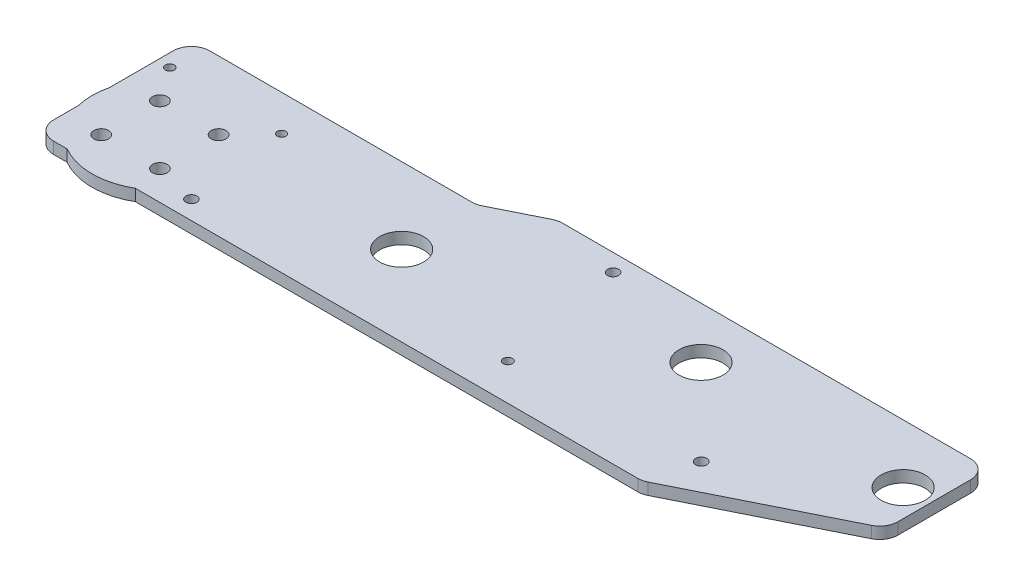
from build123d import *

# Parameters (mm, degrees)
SKETCH1_W           = 210
SKETCH1_H           = 50
SKETCH1_R           = 1.211665018
SKETCH1_R_2         = 1.165617118
SKETCH1_R_3         = 1.5
SKETCH1_R_4         = 1.25
SKETCH1_R_5         = 1.517273905
BOSS_EXTRUDE1_DEPTH = 3.175
SKETCH2_R           = 2
CUT_EXTRUDE1_DEPTH  = 10
SKETCH3_R           = 6
SKETCH3_R_2         = 0.586995366
CUT_EXTRUDE2_DEPTH  = 57.15
CUT_EXTRUDE7_DEPTH  = 10
FILLET3_R           = 5
SKETCH11_R          = 18.5
SKETCH11_R_2        = 2
BOSS_EXTRUDE4_DEPTH = 3.175


with BuildPart() as part:
    # Sketch1 → Boss-Extrude1 (new body)
    with BuildSketch(Plane(origin=(0, 0, 0), x_dir=(1, 0, 0), z_dir=(0, 1, 0))):
        with Locations((105, -25)):
            Rectangle(SKETCH1_W, SKETCH1_H)
        with Locations((3.489526233, -16.787661112)):
            Circle(SKETCH1_R, mode=Mode.SUBTRACT)
        with Locations((34.37258772, -17.194005245)):
            Circle(SKETCH1_R_2, mode=Mode.SUBTRACT)
        with Locations((37.520749958, -44.921198121)):
            Circle(SKETCH1_R_3, mode=Mode.SUBTRACT)
        with Locations((118.879039361, -40.017685043)):
            Circle(SKETCH1_R_4, mode=Mode.SUBTRACT)
        with Locations((112.302052499, -4.739260115)):
            Circle(SKETCH1_R_3, mode=Mode.SUBTRACT)
        with Locations((168.975233936, -37.403209633)):
            Circle(SKETCH1_R_5, mode=Mode.SUBTRACT)
    extrude(amount=BOSS_EXTRUDE1_DEPTH)

    # Sketch2 → Cut-Extrude1 (cut)
    with BuildSketch(Plane(origin=(0, 3.175, 0), x_dir=(1, 0, 0), z_dir=(0, 1, 0))):
        with Locations((10, -26)):
            Circle(SKETCH2_R)
        with Locations((10, -42)):
            Circle(SKETCH2_R)
        with Locations((26, -26)):
            Circle(SKETCH2_R)
        with Locations((26, -42)):
            Circle(SKETCH2_R)
    extrude(amount=-CUT_EXTRUDE1_DEPTH, mode=Mode.SUBTRACT)

    # Sketch3 → Cut-Extrude2 (cut)
    with BuildSketch(Plane(origin=(0, 3.175, 0), x_dir=(1, 0, 0), z_dir=(0, 1, 0))):
        with Locations((78.01026379, -28.1)):
            Circle(SKETCH3_R)
        with Locations((145.531297368, -14)):
            Circle(SKETCH3_R)
        with Locations((18, -34)):
            Circle(SKETCH3_R_2)
        with Locations((202.646291021, -16)):
            Circle(SKETCH3_R)
    extrude(amount=-CUT_EXTRUDE2_DEPTH, mode=Mode.SUBTRACT)

    # Sketch10 → Cut-Extrude7 (cut)
    with BuildSketch(Plane(origin=(0, 3.175, 0), x_dir=(1, 0, 0), z_dir=(0, 1, 0))):
        Polygon((210, -27.859435908), (165.502877994, -50), (210, -50), align=None)
        Polygon((92.532613397, 0), (77.65477062, -7.402812063), (0, -7.402812063), (0, 0), align=None)
    extrude(amount=-CUT_EXTRUDE7_DEPTH, mode=Mode.SUBTRACT)

    # Fillet3
    fillet3_edges = [part.edges().sort_by_distance(p)[0] for p in [
        (0, 1.5875, 50),
        (0, 1.5875, 7.402812063),
        (77.65477062, 1.5875, 7.402812063),
        (92.532613397, 1.5875, 0),
        (210, 1.5875, 0),
        (210, 1.5875, 27.859435908),
        (165.502877994, 1.5875, 50),
    ]]
    fillet(fillet3_edges, radius=FILLET3_R)

    # Sketch11 → Boss-Extrude4 (add)
    with BuildSketch(Plane(origin=(0, 3.175, 0), x_dir=(1, 0, 0), z_dir=(0, 1, 0))):
        with Locations((18, -34)):
            Circle(SKETCH11_R)
        with Locations((10, -26)):
            Circle(SKETCH11_R_2, mode=Mode.SUBTRACT)
        with Locations((10, -42)):
            Circle(SKETCH11_R_2, mode=Mode.SUBTRACT)
        with Locations((26, -26)):
            Circle(SKETCH11_R_2, mode=Mode.SUBTRACT)
        with Locations((26, -42)):
            Circle(SKETCH11_R_2, mode=Mode.SUBTRACT)
    extrude(amount=-BOSS_EXTRUDE4_DEPTH)


solid = part.part
